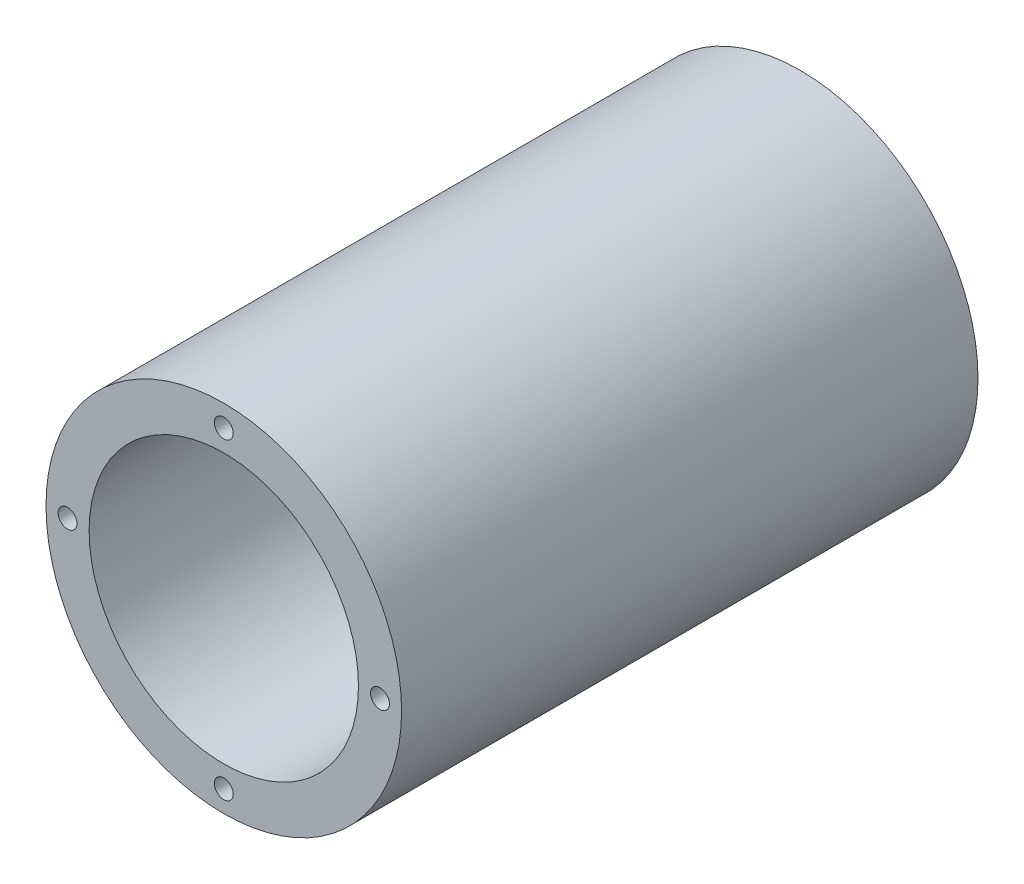
from build123d import *

# Parameters (mm, degrees)
CROQUIS1_R          = 33
CROQUIS1_R_2        = 25
BOSS_EXTRUDE1_DEPTH = 107
SKETCH1_R           = 1.5
CUT_EXTRUDE1_DEPTH  = 5
SKETCH2_R           = 1.75
CUT_EXTRUDE2_DEPTH  = 5


with BuildPart() as part:
    # Croquis1 → Boss-Extrude1 (new body)
    with BuildSketch(Plane.XY):
        Circle(CROQUIS1_R)
        Circle(CROQUIS1_R_2, mode=Mode.SUBTRACT)
    extrude(amount=BOSS_EXTRUDE1_DEPTH)

    # Sketch1 → Cut-Extrude1 (cut)
    with BuildSketch(Plane(origin=(0, 0, 0), x_dir=(-1, 0, 0), z_dir=(0, 0, -1))):
        with Locations((-29, 0)):
            Circle(SKETCH1_R)
        with Locations((0, 29)):
            Circle(SKETCH1_R)
        with Locations((29, 0)):
            Circle(SKETCH1_R)
        with Locations((0, -29)):
            Circle(SKETCH1_R)
    extrude(amount=-CUT_EXTRUDE1_DEPTH, mode=Mode.SUBTRACT)

    # Sketch2 → Cut-Extrude2 (cut)
    with BuildSketch(Plane.XY.offset(107)):
        with Locations((-29, 0)):
            Circle(SKETCH2_R)
        with Locations((0, 29)):
            Circle(SKETCH2_R)
        with Locations((29, 0)):
            Circle(SKETCH2_R)
        with Locations((0, -29)):
            Circle(SKETCH2_R)
    extrude(amount=-CUT_EXTRUDE2_DEPTH, mode=Mode.SUBTRACT)


solid = part.part
